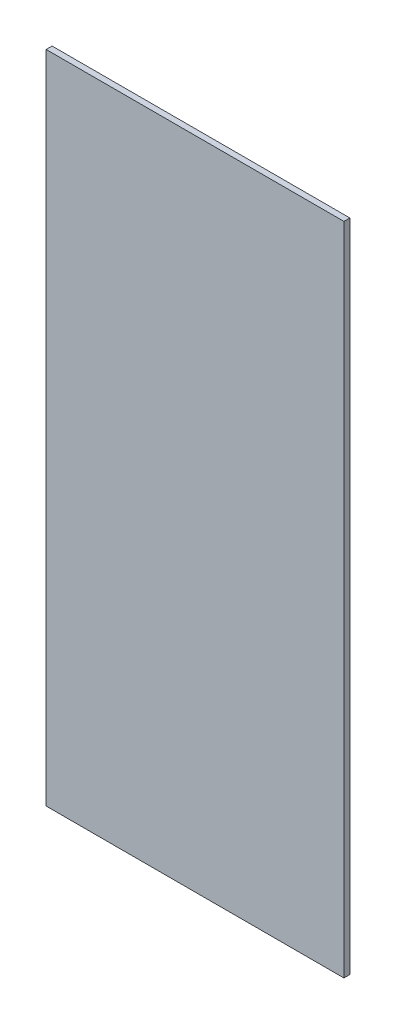
from build123d import *

# Parameters (mm, degrees)
SKETCH_1_W      = 500
SKETCH_1_H      = 1100
EXTRUDE_1_DEPTH = 10


with BuildPart() as part:
    # Эскиз1 → Бобышка-Вытянуть1 (new body)
    with BuildSketch(Plane.XY):
        with Locations((250, 550)):
            Rectangle(SKETCH_1_W, SKETCH_1_H)
    extrude(amount=EXTRUDE_1_DEPTH)


solid = part.part
